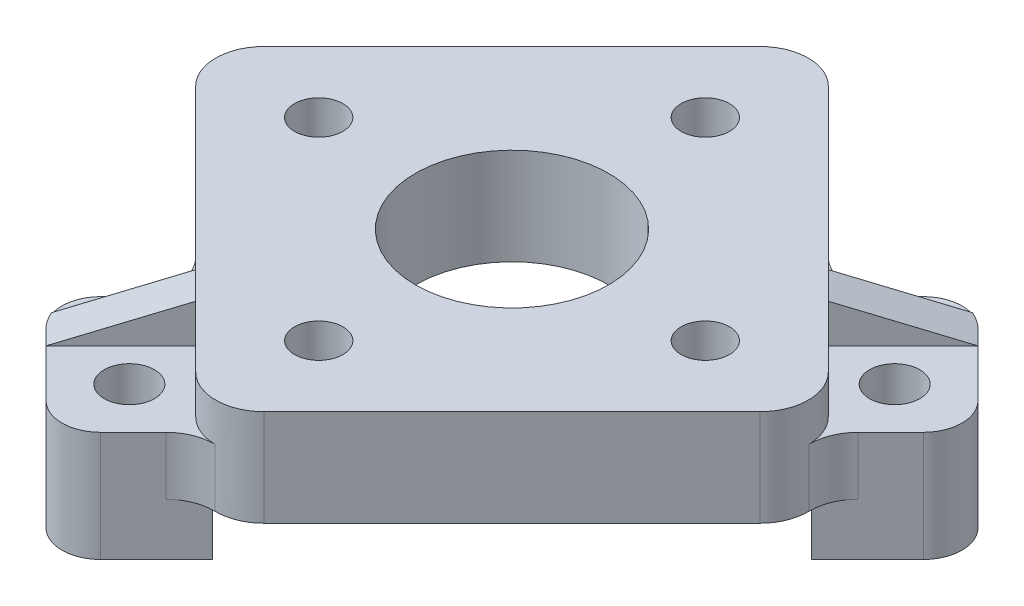
from build123d import *

# Parameters (mm, degrees)
SKETCH1_R           = 1.25
SKETCH1_R_2         = 5
BOSS_EXTRUDE1_DEPTH = 5
SKETCH4_R           = 3
CUT_EXTRUDE2_DEPTH  = 3
SKETCH3_R           = 1.3
BOSS_EXTRUDE4_DEPTH = 5.7
BOSS_EXTRUDE6_DEPTH = 1
FILLET1_R           = 2.5
FILLET2_R           = 2


with BuildPart() as part:
    # Sketch1 → Boss-Extrude1 (new body)
    with BuildSketch(Plane(origin=(0, 0, 0), x_dir=(1, 0, 0), z_dir=(0, 1, 0))):
        with BuildLine():
            Line((1.767766953, 14.596194078), (14.596194078, 1.767766953))
            ThreePointArc((14.596194078, 1.767766953), (15.328427125, 0), (14.596194078, -1.767766953))
            Line((14.596194078, -1.767766953), (1.767766953, -14.596194078))
            ThreePointArc((1.767766953, -14.596194078), (0, -15.328427125), (-1.767766953, -14.596194078))
            Line((-1.767766953, -14.596194078), (-14.596194078, -1.767766953))
            ThreePointArc((-14.596194078, -1.767766953), (-15.328427125, 0), (-14.596194078, 1.767766953))
            Line((-14.596194078, 1.767766953), (-1.767766953, 14.596194078))
            ThreePointArc((-1.767766953, 14.596194078), (0, 15.328427125), (1.767766953, 14.596194078))
        make_face()
        with Locations(Location((0, 10, 0), (0, 0, 270))):
            Circle(SKETCH1_R, mode=Mode.SUBTRACT)
        with Locations(Location((0, -10, 0), (0, 0, 270))):
            Circle(SKETCH1_R, mode=Mode.SUBTRACT)
        with Locations(Location((10, 0, 0), (0, 0, 270))):
            Circle(SKETCH1_R, mode=Mode.SUBTRACT)
        with Locations(Location((-10, 0, 0), (0, 0, 270))):
            Circle(SKETCH1_R, mode=Mode.SUBTRACT)
        with Locations(Location((0, 0, 0), (0, 0, 270))):
            Circle(SKETCH1_R_2, mode=Mode.SUBTRACT)
    extrude(amount=BOSS_EXTRUDE1_DEPTH)

    # Sketch4 → Cut-Extrude2 (cut)
    with BuildSketch(Plane.XZ):
        with Locations(Location((0, 10, 0), (0, 0, 270))):
            Circle(SKETCH4_R)
        with Locations(Location((10, 0, 0), (0, 0, 270))):
            Circle(SKETCH4_R)
        with Locations(Location((-10, 0, 0), (0, 0, 270))):
            Circle(SKETCH4_R)
        with Locations(Location((0, -10, 0), (0, 0, 270))):
            Circle(SKETCH4_R)
    extrude(amount=-CUT_EXTRUDE2_DEPTH, mode=Mode.SUBTRACT)

    # Sketch3 → Boss-Extrude4 (add)
    # profile 1 of 4: a face of its own
    with BuildSketch(Plane(origin=(0, -2.7, 0), x_dir=(1, 0, 0), z_dir=(0, 1, 0))):
        Polygon((-4.949747468, -10.537489101), (-0.637994164, -14.849242405), (-4.949747468, -19.160995709), (-9.261500772, -14.849242405), align=None)
        with Locations(Location((-4.949747468, -14.849242405, 0), (0, 0, 90))):
            Circle(SKETCH3_R, mode=Mode.SUBTRACT)
    # profile 2 of 4: a face of its own
    with BuildSketch(Plane(origin=(0, -2.7, 0), x_dir=(1, 0, 0), z_dir=(0, 1, 0))):
        Polygon((-6.717514421, -8.769722148), (-11.029267725, -13.081475452), (-9.261500772, -14.849242405), (-4.949747468, -10.537489101), align=None)
    # profile 3 of 4: a face of its own
    with BuildSketch(Plane(origin=(0, -2.7, 0), x_dir=(1, 0, 0), z_dir=(0, 1, 0))):
        Polygon((19.160995709, 4.949747468), (14.849242405, 9.261500772), (10.537489101, 4.949747468), (14.849242405, 0.637994164), align=None)
        with Locations(Location((14.849242405, 4.949747468, 0), (0, 0, 90))):
            Circle(SKETCH3_R, mode=Mode.SUBTRACT)
    # profile 4 of 4: a face of its own
    with BuildSketch(Plane(origin=(0, -2.7, 0), x_dir=(1, 0, 0), z_dir=(0, 1, 0))):
        Polygon((13.081475452, 11.029267725), (14.849242405, 9.261500772), (10.537489101, 4.949747468), (8.769722148, 6.717514421), align=None)
    extrude(amount=BOSS_EXTRUDE4_DEPTH)


with BuildPart() as boss_extrude6_tool:
    # Sketch7 → Boss-Extrude6 (new, symmetric)
    with BuildSketch(Plane(origin=(2.525126055, -2.13e-07, 2.525126055), x_dir=(0.7071067811865474, 0, -0.7071067811865477), z_dir=(0.7071067811865465, -5.960464483662305e-08, 0.7071067811865461))):
        Polygon((11.571067812, 5.000000541), (17.04887, 3.000000599), (11.571067812, 3.000000541), align=None)
        Polygon((-11.571067812, 5.000000541), (-17.04887, 3.000000599), (-11.571067812, 3.000000541), align=None)
    extrude(amount=BOSS_EXTRUDE6_DEPTH, both=True)


with BuildPart() as part_1:
    add(part.part)


with BuildPart() as part_2:
    # Boss-Extrude6: joined with boss_extrude6_tool
    add(part_1.part.fuse(boss_extrude6_tool.part, tol=0.00001))

    # Fillet1
    fillet1_edges = [part_2.edges().sort_by_distance(p)[0] for p in [
        (-7.155876652, 1.5, 9.208084379),
        (-0.935534875, 1.5, 15.146783115),
        (9.208084379, 1.5, -7.155876652),
        (15.146783115, 1.5, -0.935534875),
    ]]
    fillet(fillet1_edges, radius=FILLET1_R)

    # Fillet2
    # the kernel refuses this fillet: 2 mm, written as the material it takes off along each edge
    with BuildSketch(Plane(origin=(-4.949747468, -7.7, 19.160995709), x_dir=(-0.7071067811865471, 0, -0.707106781186548), z_dir=(0, 1, 0)), Plane(origin=(13.081475452, -7.7, -11.029267725), x_dir=(0.7071067811865476, 0, 0.7071067811865476), z_dir=(0, 1, 0))) as fillet2_piece_1:
        with BuildLine():
            CenterArc((FILLET2_R, -FILLET2_R), FILLET2_R, 90, 90)
            Line((0, -FILLET2_R), (0, 0))
            Line((0, 0), (FILLET2_R, 0))
        make_face()
    extrude(amount=15.7, mode=Mode.SUBTRACT)
    with BuildSketch(Plane(origin=(-11.029267725, -7.7, 13.081475452), x_dir=(0.707106781186547, 0, 0.7071067811865479), z_dir=(0, 1, 0)), Plane(origin=(19.160995709, -7.7, -4.949747468), x_dir=(-0.7071067811865482, 0, -0.7071067811865469), z_dir=(0, 1, 0))) as fillet2_piece_2:
        with BuildLine():
            CenterArc((FILLET2_R, FILLET2_R), FILLET2_R, 180, 90)
            Line((0, FILLET2_R), (0, 0))
            Line((0, 0), (FILLET2_R, 0))
        make_face()
    extrude(amount=15.7, mode=Mode.SUBTRACT)


solid = part_2.part
